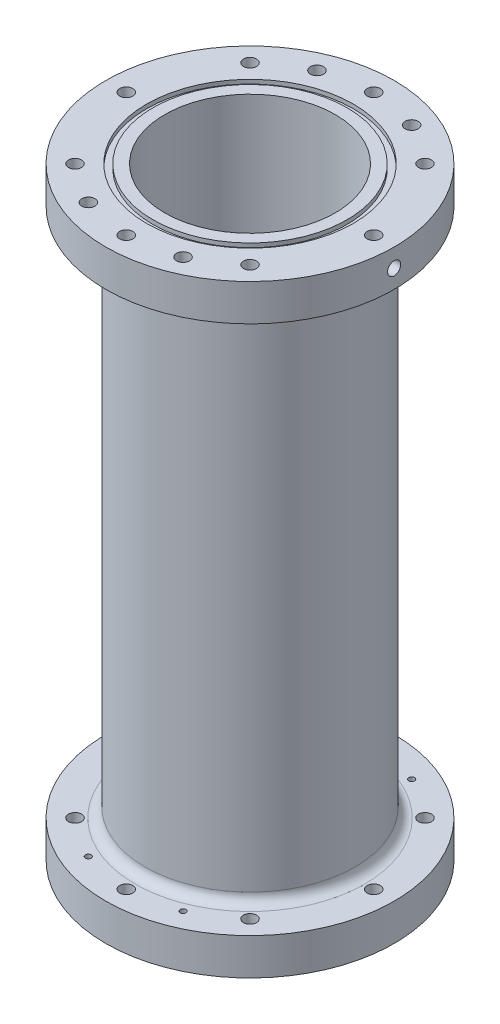
from build123d import *

# Parameters (mm, degrees)
SKETCH2_R               = 50.8
SKETCH2_R_2             = 41.275
BASE_CYLINDER_DEPTH     = 292.1
SKETCH3_R               = 69.85
SKETCH3_R_2             = 41.275
AFT_FLANGE_DEPTH        = 17.78
FORWARD_START           = -17.78
SKETCH4_R               = 69.85
SKETCH4_R_2             = 41.275
FORWARD_FLANGE_DEPTH    = 17.78
SKETCH6_R               = 50.0761
SKETCH6_R_2             = 47.0027
O_RING_SLOT_1_DEPTH     = 1.9812
O_RING_START            = -1.9812
SKETCH7_R               = 50.0761
SKETCH7_R_2             = 47.0027
O_RING_SLOT_2_DEPTH     = 1.9812
CUT_EXTRUDE4_DEPTH      = 309.351187771
CUT_EXTRUDE4_DEPTH_BACK = 309.351187771
SKETCH8_R               = 3.175
FILLET1_R               = 4.7625
SKETCH9_R               = 3.175
CUT_EXTRUDE5_DEPTH      = 7.62
CUT_EXTRUDE6_START      = -7.62
SKETCH10_R              = 3.175
CUT_EXTRUDE6_DEPTH      = 7.62
CUT_EXTRUDE7_REACH      = 303.143
SKETCH11_R              = 1.4097
CUT_EXTRUDE8_REACH      = 303.143
SKETCH12_R              = 1.4097
SKETCH13_R              = 3.175
CUT_EXTRUDE10_DEPTH     = 6.35
CUT_EXTRUDE11_START     = -6.35
SKETCH14_R              = 3.175
CUT_EXTRUDE11_DEPTH     = 6.35


with BuildPart() as part:
    # Sketch2 → Base Cylinder (new body)
    with BuildSketch(Plane(origin=(0, 0, 0), x_dir=(1, 0, 0), z_dir=(0, 1, 0))):
        Circle(SKETCH2_R)
        Circle(SKETCH2_R_2, mode=Mode.SUBTRACT)
    extrude(amount=BASE_CYLINDER_DEPTH)

    # Sketch3 → Aft Flange (add)
    with BuildSketch(Plane.XZ):
        Circle(SKETCH3_R)
        Circle(SKETCH3_R_2, mode=Mode.SUBTRACT)
    extrude(amount=-AFT_FLANGE_DEPTH)

    # Sketch4 → Forward Flange (add)
    with BuildSketch(Plane(origin=(0, 292.1, 0), x_dir=(1, 0, 0), z_dir=(0, 1, 0)).offset(FORWARD_START)):
        Circle(SKETCH4_R)
        Circle(SKETCH4_R_2, mode=Mode.SUBTRACT)
    extrude(amount=FORWARD_FLANGE_DEPTH)

    # Sketch6 → O-Ring Slot 1 (cut)
    with BuildSketch(Plane.XZ):
        Circle(SKETCH6_R)
        Circle(SKETCH6_R_2, mode=Mode.SUBTRACT)
    extrude(amount=-O_RING_SLOT_1_DEPTH, mode=Mode.SUBTRACT)

    # Sketch7 → O-Ring Slot 2 (cut)
    with BuildSketch(Plane(origin=(0, 292.1, 0), x_dir=(1, 0, 0), z_dir=(0, 1, 0)).offset(O_RING_START)):
        Circle(SKETCH7_R)
        Circle(SKETCH7_R_2, mode=Mode.SUBTRACT)
    extrude(amount=O_RING_SLOT_2_DEPTH, mode=Mode.SUBTRACT)

    # Sketch8 → Cut-Extrude4 (cut, two sides: drawn at the far end of the back side and taken through both)
    with BuildSketch(Plane.XZ.offset(-CUT_EXTRUDE4_DEPTH_BACK)):
        with Locations((-59.9186, 0)):
            Circle(SKETCH8_R)
        with Locations((-42.368848379, 42.368848379)):
            Circle(SKETCH8_R)
        with Locations((0, 59.9186)):
            Circle(SKETCH8_R)
        with Locations((42.368848379, 42.368848379)):
            Circle(SKETCH8_R)
        with Locations((59.9186, 0)):
            Circle(SKETCH8_R)
        with Locations((42.368848379, -42.368848379)):
            Circle(SKETCH8_R)
        with Locations((0, -59.9186)):
            Circle(SKETCH8_R)
        with Locations((-42.368848379, -42.368848379)):
            Circle(SKETCH8_R)
    extrude(amount=CUT_EXTRUDE4_DEPTH + CUT_EXTRUDE4_DEPTH_BACK, mode=Mode.SUBTRACT)

    # Fillet1
    fillet1_edges = [part.edges().sort_by_distance(p)[0] for p in [
        (-50.8, 17.78, 0),
        (-50.8, 274.32, 0),
    ]]
    fillet(fillet1_edges, radius=FILLET1_R)

    # Sketch9 → Cut-Extrude5 (cut)
    with BuildSketch(Plane(origin=(0, 292.1, 0), x_dir=(1, 0, 0), z_dir=(0, 1, 0))):
        with Locations((-22.929855511, 55.357568157)):
            Circle(SKETCH9_R)
        with Locations((22.929855511, -55.357568157)):
            Circle(SKETCH9_R)
        with Locations((22.929855511, 55.357568157)):
            Circle(SKETCH9_R)
        with Locations((-22.929855511, -55.357568157)):
            Circle(SKETCH9_R)
    extrude(amount=-CUT_EXTRUDE5_DEPTH, mode=Mode.SUBTRACT)

    # Sketch10 → Cut-Extrude6 (cut)
    with BuildSketch(Plane.XZ.offset(CUT_EXTRUDE6_START)):
        with Locations((-22.929855511, 55.357568157)):
            Circle(SKETCH10_R)
        with Locations((22.929855511, -55.357568157)):
            Circle(SKETCH10_R)
        with Locations((22.929855511, 55.357568157)):
            Circle(SKETCH10_R)
        with Locations((-22.929855511, -55.357568157)):
            Circle(SKETCH10_R)
    extrude(amount=CUT_EXTRUDE6_DEPTH, mode=Mode.SUBTRACT)

    # Sketch11 → Cut-Extrude7 (cut, up to next)
    with BuildSketch(Plane(origin=(0, 284.48, 0), x_dir=(1, 0, 0), z_dir=(0, 1, 0)), mode=Mode.PRIVATE) as cut_extrude7_sk1:
        with Locations((-22.929855511, 55.357568157)):
            Circle(SKETCH11_R)
    cut_extrude7_tool1 = extrude(cut_extrude7_sk1.sketch, amount=-CUT_EXTRUDE7_REACH, mode=Mode.PRIVATE) & part.part
    # Sketch11 → Cut-Extrude7 (cut, up to next)
    with BuildSketch(Plane(origin=(0, 284.48, 0), x_dir=(1, 0, 0), z_dir=(0, 1, 0)), mode=Mode.PRIVATE) as cut_extrude7_sk2:
        with Locations((22.929855511, 55.357568157)):
            Circle(SKETCH11_R)
    cut_extrude7_tool2 = extrude(cut_extrude7_sk2.sketch, amount=-CUT_EXTRUDE7_REACH, mode=Mode.PRIVATE) & part.part
    # Sketch11 → Cut-Extrude7 (cut, up to next)
    with BuildSketch(Plane(origin=(0, 284.48, 0), x_dir=(1, 0, 0), z_dir=(0, 1, 0)), mode=Mode.PRIVATE) as cut_extrude7_sk3:
        with Locations((-22.929855511, -55.357568157)):
            Circle(SKETCH11_R)
    cut_extrude7_tool3 = extrude(cut_extrude7_sk3.sketch, amount=-CUT_EXTRUDE7_REACH, mode=Mode.PRIVATE) & part.part
    # Sketch11 → Cut-Extrude7 (cut, up to next)
    with BuildSketch(Plane(origin=(0, 284.48, 0), x_dir=(1, 0, 0), z_dir=(0, 1, 0)), mode=Mode.PRIVATE) as cut_extrude7_sk4:
        with Locations((22.929855511, -55.357568157)):
            Circle(SKETCH11_R)
    cut_extrude7_tool4 = extrude(cut_extrude7_sk4.sketch, amount=-CUT_EXTRUDE7_REACH, mode=Mode.PRIVATE) & part.part
    add(cut_extrude7_tool1.solids().sort_by_distance((-22.929856, 284.48, -55.357568))[0], mode=Mode.SUBTRACT)
    add(cut_extrude7_tool2.solids().sort_by_distance((22.929856, 284.48, -55.357568))[0], mode=Mode.SUBTRACT)
    add(cut_extrude7_tool3.solids().sort_by_distance((-22.929856, 284.48, 55.357568))[0], mode=Mode.SUBTRACT)
    add(cut_extrude7_tool4.solids().sort_by_distance((22.929856, 284.48, 55.357568))[0], mode=Mode.SUBTRACT)

    # Sketch12 → Cut-Extrude8 (cut, up to next)
    with BuildSketch(Plane.XZ.offset(-7.62), mode=Mode.PRIVATE) as cut_extrude8_sk1:
        with Locations((-22.929855511, 55.357568157)):
            Circle(SKETCH12_R)
    cut_extrude8_tool1 = extrude(cut_extrude8_sk1.sketch, amount=-CUT_EXTRUDE8_REACH, mode=Mode.PRIVATE) & part.part
    # Sketch12 → Cut-Extrude8 (cut, up to next)
    with BuildSketch(Plane.XZ.offset(-7.62), mode=Mode.PRIVATE) as cut_extrude8_sk2:
        with Locations((22.929855511, 55.357568157)):
            Circle(SKETCH12_R)
    cut_extrude8_tool2 = extrude(cut_extrude8_sk2.sketch, amount=-CUT_EXTRUDE8_REACH, mode=Mode.PRIVATE) & part.part
    # Sketch12 → Cut-Extrude8 (cut, up to next)
    with BuildSketch(Plane.XZ.offset(-7.62), mode=Mode.PRIVATE) as cut_extrude8_sk3:
        with Locations((-22.929855511, -55.357568157)):
            Circle(SKETCH12_R)
    cut_extrude8_tool3 = extrude(cut_extrude8_sk3.sketch, amount=-CUT_EXTRUDE8_REACH, mode=Mode.PRIVATE) & part.part
    # Sketch12 → Cut-Extrude8 (cut, up to next)
    with BuildSketch(Plane.XZ.offset(-7.62), mode=Mode.PRIVATE) as cut_extrude8_sk4:
        with Locations((22.929855511, -55.357568157)):
            Circle(SKETCH12_R)
    cut_extrude8_tool4 = extrude(cut_extrude8_sk4.sketch, amount=-CUT_EXTRUDE8_REACH, mode=Mode.PRIVATE) & part.part
    add(cut_extrude8_tool1.solids().sort_by_distance((-22.929856, 7.62, 55.357568))[0], mode=Mode.SUBTRACT)
    add(cut_extrude8_tool2.solids().sort_by_distance((22.929856, 7.62, 55.357568))[0], mode=Mode.SUBTRACT)
    add(cut_extrude8_tool3.solids().sort_by_distance((-22.929856, 7.62, -55.357568))[0], mode=Mode.SUBTRACT)
    add(cut_extrude8_tool4.solids().sort_by_distance((22.929856, 7.62, -55.357568))[0], mode=Mode.SUBTRACT)

    # Sketch13 → Cut-Extrude10 (cut)
    with BuildSketch(Plane(origin=(-69.85, 0, 0), x_dir=(0, 0, -1), z_dir=(1, 0, 0))):
        with Locations((0, 283.21)):
            Circle(SKETCH13_R)
    extrude(amount=CUT_EXTRUDE10_DEPTH, mode=Mode.SUBTRACT)

    # Sketch14 → Cut-Extrude11 (cut)
    with BuildSketch(Plane(origin=(69.85, 0, 0), x_dir=(0, 0, -1), z_dir=(1, 0, 0)).offset(CUT_EXTRUDE11_START)):
        with Locations((0, 283.21)):
            Circle(SKETCH14_R)
    extrude(amount=CUT_EXTRUDE11_DEPTH, mode=Mode.SUBTRACT)


solid = part.part
